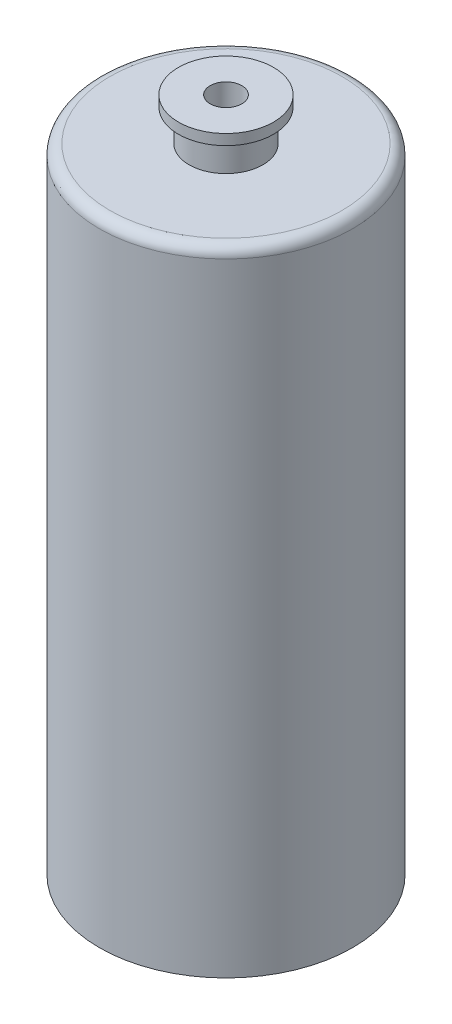
from build123d import *

# Parameters (mm, degrees)
SKETCH1_R           = 76.2
BOSS_EXTRUDE1_DEPTH = 381
FILLET1_R           = 6.35
SHELL4_START        = 25.4
SHELL4_OUTLINE_R    = 55.88
SHELL4_DEPTH        = 335.28
SKETCH3_R           = 9.525
CUT_EXTRUDE1_DEPTH  = 20.32


# Read off the part's stored shape, not the designer's step: Shell4
with BuildPart() as part:
    # Sketch1 → Boss-Extrude1 (new body)
    with BuildSketch(Plane(origin=(0, 0, 0), x_dir=(1, 0, 0), z_dir=(0, 1, 0))):
        with Locations(Location((0, 0, 0), (0, 0, 270))):
            Circle(SKETCH1_R)
    extrude(amount=BOSS_EXTRUDE1_DEPTH)

    # Fillet1
    fillet1_edges = [part.edges().sort_by_distance(p)[0] for p in [
        (0, 381, -76.2),
    ]]
    fillet(fillet1_edges, radius=FILLET1_R)

    # Sketch2 → Revolve1 (revolve)
    with BuildSketch(Plane.XY, mode=Mode.PRIVATE) as revolve1_sk:
        Polygon((-9.525, 381), (-9.525, 406.4), (-28.575, 406.4), (-28.575, 400.05), (-22.225, 400.05), (-22.225, 381), align=None)
    revolve(revolve1_sk.sketch.rotate(Axis((0, -1000, 0), (0, 1, 0)), 180), axis=Axis((0, -1000, 0), (0, 1, 0)))

    # Shell4 outline → Shell4 (cut)
    with BuildSketch(Plane(origin=(0, 0, 0), x_dir=(1, 0, 0), z_dir=(0, 1, 0)).offset(SHELL4_START)):
        Circle(SHELL4_OUTLINE_R)
    extrude(amount=SHELL4_DEPTH, mode=Mode.SUBTRACT)

    # Sketch3 → Cut-Extrude1 (cut)
    with BuildSketch(Plane(origin=(0, 381, 0), x_dir=(1, 0, 0), z_dir=(0, 1, 0))):
        Circle(SKETCH3_R)
    extrude(amount=-CUT_EXTRUDE1_DEPTH, mode=Mode.SUBTRACT)


solid = part.part
